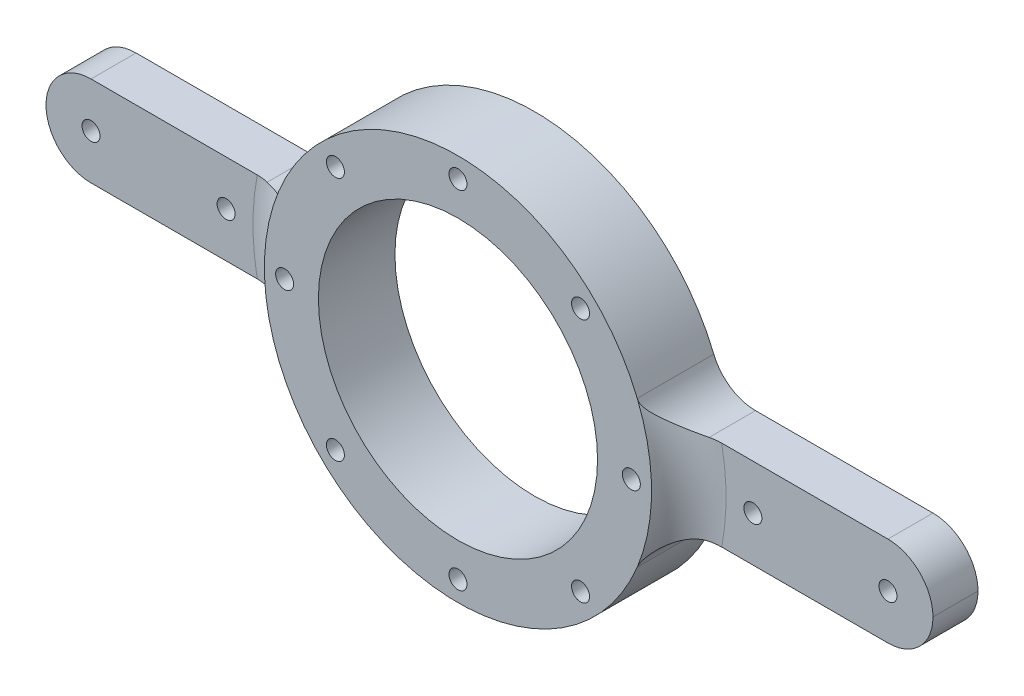
from build123d import *

# Parameters (mm, degrees)
SKETCH1_R           = 2
SKETCH1_R_2         = 31
BOSS_EXTRUDE1_DEPTH = 17
SKETCH1_3_R         = 2
BOSS_EXTRUDE2_DEPTH = 10
FILLET1_R           = 10
FILLET2_R           = 10


# Some blends are built 0.0001 mm under size
with BuildPart() as part:
    # Sketch1 → Boss-Extrude1 (new body)
    with BuildSketch(Plane.XY):
        with BuildLine():
            ThreePointArc((41.821047333, 10), (0, 43), (-41.821047333, 10))
            ThreePointArc((-41.821047333, 10), (-43, 0), (-41.821047333, -10))
            ThreePointArc((-41.821047333, -10), (-41.80718648, -10.057790941), (-41.793245769, -10.11556267))
            ThreePointArc((-41.793245769, -10.11556267), (-0.129174326, -42.999805976), (41.731716335, -10.366477306))
            ThreePointArc((41.731716335, -10.366477306), (41.776783691, -10.183336608), (41.821047333, -10))
            ThreePointArc((41.821047333, -10), (43, 0), (41.821047333, 10))
        make_face()
        with Locations((-27.223611076, -27.223611076)):
            Circle(SKETCH1_R, mode=Mode.SUBTRACT)
        with Locations((0, -38.5)):
            Circle(SKETCH1_R, mode=Mode.SUBTRACT)
        with Locations((27.223611076, -27.223611076)):
            Circle(SKETCH1_R, mode=Mode.SUBTRACT)
        with Locations((-38.5, 0)):
            Circle(SKETCH1_R, mode=Mode.SUBTRACT)
        with Locations((-27.223611076, 27.223611076)):
            Circle(SKETCH1_R, mode=Mode.SUBTRACT)
        Circle(SKETCH1_R_2, mode=Mode.SUBTRACT)
        with Locations((38.5, 0)):
            Circle(SKETCH1_R, mode=Mode.SUBTRACT)
        with Locations((27.223611076, 27.223611076)):
            Circle(SKETCH1_R, mode=Mode.SUBTRACT)
        with Locations((0, 38.5)):
            Circle(SKETCH1_R, mode=Mode.SUBTRACT)
    extrude(amount=BOSS_EXTRUDE1_DEPTH)

    # Sketch1<3> → Boss-Extrude2 (add)
    # profile 1 of 2: a face of its own
    with BuildSketch(Plane.XY):
        with BuildLine():
            ThreePointArc((-41.821047333, -10), (-43, 0), (-41.821047333, 10))
            Line((-41.821047333, 10), (-98.5, 10))
            Line((-98.5, 10), (-98.5, -10))
            Line((-98.5, -10), (-41.821047333, -10))
        make_face()
        with Locations((-88.5, 0)):
            Circle(SKETCH1_3_R, mode=Mode.SUBTRACT)
        with Locations((-58.5, 0)):
            Circle(SKETCH1_3_R, mode=Mode.SUBTRACT)
    # profile 2 of 2: a face of its own
    with BuildSketch(Plane.XY):
        with BuildLine():
            Line((98.5, 10), (41.821047333, 10))
            ThreePointArc((41.821047333, 10), (43, 0), (41.821047333, -10))
            Line((41.821047333, -10), (98.5, -10))
            Line((98.5, -10), (98.5, 10))
        make_face()
        with Locations((58.5, 0)):
            Circle(SKETCH1_3_R, mode=Mode.SUBTRACT)
        with Locations((88.5, 0)):
            Circle(SKETCH1_3_R, mode=Mode.SUBTRACT)
    extrude(amount=BOSS_EXTRUDE2_DEPTH)

    # Fillet1
    # the kernel refuses this fillet: 10 mm, written as the material it adds along each edge
    with BuildSketch(Plane(origin=(0, 0, 10), x_dir=(-0.7043119936118605, -0.7098905659709015, 0), z_dir=(0.7098905659709015, -0.7043119936118605, 0))) as fillet1_piece_1_section:
        with BuildLine():
            CenterArc((52.539392014, -10), FILLET1_R, 90, 72.542396876)
            Line((52.539392014, 0), (52.539392014, 0.2))
            Line((52.539392014, 0.2), (43, 0.2))
            Line((43, 0.2), (42.8, 0))
            ThreePointArc((42.8, 0), (42.8, -3.5), (42.80921216, -6.94))
            Line((42.80921216, -6.94), (43, -7))
        make_face()
    fillet1_piece_1 = revolve(axis=Axis((0, 0, 10), (0, 0, -1)), revolution_arc=90.452024347, mode=Mode.PRIVATE)
    fillet1_piece_1 = split(fillet1_piece_1, bisect_by=Plane(origin=(-44.895509483, 10, 11.788543671), z_dir=(0, -1, 0)), keep=Keep.TOP, mode=Mode.PRIVATE)
    fillet1_piece_1 = split(fillet1_piece_1, bisect_by=Plane(origin=(-44.895509483, -10, 11.788543671), z_dir=(0, 1, 0)), keep=Keep.TOP, mode=Mode.PRIVATE)
    add(fillet1_piece_1)
    with BuildSketch(Plane(origin=(-41.821047333, -10, 0), x_dir=(0.30584389927154154, -0.952081671537888, 0), z_dir=(0, 0, 1)), Plane(origin=(41.821047333, 10, 0), x_dir=(-0.30584389927146016, 0.9520816715379143, 0), z_dir=(0, 0, 1))) as fillet1_piece_2:
        with BuildLine():
            CenterArc((7.300231752, -9.971044568), FILLET1_R, 94.36121506, 67.829842836)
            Line((-2.220584963, -6.912605575), (-2.411001297, -6.851436795))
            Line((-2.411001297, -6.851436795), (-0.190416334, 0.06116878))
            Line((-0.190416334, 0.06116878), (0.015208816, 0.199420891))
            ThreePointArc((0.015208816, 0.199420891), (3.269895472, 0.075491643), (6.524582129, 0.199420891))
            Line((6.524582129, 0.199420891), (6.539790945, 0))
        make_face()
    extrude(amount=10)
    with BuildSketch(Plane(origin=(-41.821047333, 10, 0), x_dir=(0.3058438992715413, 0.9520816715378883, 0), z_dir=(0, 0, 1)), Plane(origin=(41.821047333, -10, 0), x_dir=(-0.30584389927145916, -0.9520816715379147, 0), z_dir=(0, 0, 1))) as fillet1_piece_3:
        with BuildLine():
            CenterArc((7.300231752, 9.971044568), FILLET1_R, 197.808942104, 67.829842836)
            Line((-2.220584963, 6.912605575), (-2.411001297, 6.851436795))
            Line((-2.411001297, 6.851436795), (-0.190416334, -0.06116878))
            Line((-0.190416334, -0.06116878), (0.015208816, -0.199420891))
            ThreePointArc((0.015208816, -0.199420891), (3.269895472, -0.075491643), (6.524582129, -0.199420891))
            Line((6.524582129, -0.199420891), (6.539790945, 0))
        make_face()
    extrude(amount=10)
    with BuildSketch(Plane(origin=(0, 0, 10), x_dir=(0.7043119936118566, 0.709890565970905, 0), z_dir=(-0.709890565970905, 0.7043119936118566, 0))) as fillet1_piece_4_section:
        with BuildLine():
            CenterArc((52.539392014, -10), FILLET1_R, 90, 72.542396876)
            Line((52.539392014, 0), (52.539392014, 0.2))
            Line((52.539392014, 0.2), (43, 0.2))
            Line((43, 0.2), (42.8, 0))
            ThreePointArc((42.8, 0), (42.8, -3.5), (42.80921216, -6.94))
            Line((42.80921216, -6.94), (43, -7))
        make_face()
    fillet1_piece_4 = revolve(axis=Axis((0, 0, 10), (0, 0, -1)), revolution_arc=90.452024347, mode=Mode.PRIVATE)
    fillet1_piece_4 = split(fillet1_piece_4, bisect_by=Plane(origin=(44.895509483, -10, 11.788543671), z_dir=(0, 1, 0)), keep=Keep.TOP, mode=Mode.PRIVATE)
    fillet1_piece_4 = split(fillet1_piece_4, bisect_by=Plane(origin=(44.895509483, 10, 11.788543671), z_dir=(0, -1, 0)), keep=Keep.TOP, mode=Mode.PRIVATE)
    add(fillet1_piece_4)
    with BuildSketch(Plane(origin=(0, 0, 10), x_dir=(-0.7043119936118605, -0.7098905659709015, 0), z_dir=(0.7098905659709015, -0.7043119936118605, 0))) as fillet1_piece_5a_section:
        with BuildLine():
            CenterArc((52.539392014, -10), FILLET1_R, 90, 72.542396876)
            Line((52.539392014, 0), (52.539392014, 0.2))
            Line((52.539392014, 0.2), (43, 0.2))
            Line((43, 0.2), (42.8, 0))
            ThreePointArc((42.8, 0), (42.8, -3.5), (42.80921216, -6.94))
            Line((42.80921216, -6.94), (43, -7))
        make_face()
    fillet1_piece_5a = revolve(axis=Axis((0, 0, 10), (0, 0, -1)), revolution_arc=90.452024347, mode=Mode.PRIVATE)
    fillet1_piece_5a = split(fillet1_piece_5a, bisect_by=Plane(origin=(-39.191113565, -10, 11.725292832), z_dir=(0, -1, 0)), keep=Keep.TOP, mode=Mode.PRIVATE)
    with BuildSketch(Plane(origin=(-41.821047333, -10, 0), x_dir=(0.30584389927154154, -0.952081671537888, 0), z_dir=(0, 0, 1))) as fillet1_piece_5b_section:
        with BuildLine():
            CenterArc((7.300231752, -9.971044568), FILLET1_R, 94.36121506, 67.829842836)
            Line((-2.220584963, -6.912605575), (-2.411001297, -6.851436795))
            Line((-2.411001297, -6.851436795), (-0.190416334, 0.06116878))
            Line((-0.190416334, 0.06116878), (0.015208816, 0.199420891))
            ThreePointArc((0.015208816, 0.199420891), (3.269895472, 0.075491643), (6.524582129, 0.199420891))
            Line((6.524582129, 0.199420891), (6.539790945, 0))
        make_face()
    fillet1_piece_5b = extrude(amount=28.151293586, mode=Mode.PRIVATE)
    fillet1_piece_5b = split(fillet1_piece_5b, bisect_by=Plane(origin=(-43.086853449, -11.367069141, 17), z_dir=(0, 0, -1)), keep=Keep.TOP, mode=Mode.PRIVATE)
    fillet1_piece_5b = split(fillet1_piece_5b, bisect_by=Plane(origin=(-43.086853449, -11.367069141, 10), z_dir=(0, 0, 1)), keep=Keep.TOP, mode=Mode.PRIVATE)
    fillet1_piece_5 = fillet1_piece_5a & fillet1_piece_5b
    add(fillet1_piece_5)
    with BuildSketch(Plane(origin=(-41.821047333, 10, 0), x_dir=(0.3058438992715413, 0.9520816715378883, 0), z_dir=(0, 0, 1))) as fillet1_piece_6a_section:
        with BuildLine():
            CenterArc((7.300231752, 9.971044568), FILLET1_R, 197.808942104, 67.829842836)
            Line((-2.220584963, 6.912605575), (-2.411001297, 6.851436795))
            Line((-2.411001297, 6.851436795), (-0.190416334, -0.06116878))
            Line((-0.190416334, -0.06116878), (0.015208816, -0.199420891))
            ThreePointArc((0.015208816, -0.199420891), (3.269895472, -0.075491643), (6.524582129, -0.199420891))
            Line((6.524582129, -0.199420891), (6.539790945, 0))
        make_face()
    fillet1_piece_6a = extrude(amount=28.151293586, mode=Mode.PRIVATE)
    fillet1_piece_6a = split(fillet1_piece_6a, bisect_by=Plane(origin=(-43.086853449, 11.367069141, 17), z_dir=(0, 0, -1)), keep=Keep.TOP, mode=Mode.PRIVATE)
    fillet1_piece_6a = split(fillet1_piece_6a, bisect_by=Plane(origin=(-43.086853449, 11.367069141, 10), z_dir=(0, 0, 1)), keep=Keep.TOP, mode=Mode.PRIVATE)
    with BuildSketch(Plane(origin=(0, 0, 10), x_dir=(-0.7043119936118605, -0.7098905659709015, 0), z_dir=(0.7098905659709015, -0.7043119936118605, 0))) as fillet1_piece_6b_section:
        with BuildLine():
            CenterArc((52.539392014, -10), FILLET1_R, 90, 72.542396876)
            Line((52.539392014, 0), (52.539392014, 0.2))
            Line((52.539392014, 0.2), (43, 0.2))
            Line((43, 0.2), (42.8, 0))
            ThreePointArc((42.8, 0), (42.8, -3.5), (42.80921216, -6.94))
            Line((42.80921216, -6.94), (43, -7))
        make_face()
    fillet1_piece_6b = revolve(axis=Axis((0, 0, 10), (0, 0, -1)), revolution_arc=90.452024347, mode=Mode.PRIVATE)
    fillet1_piece_6b = split(fillet1_piece_6b, bisect_by=Plane(origin=(-39.191113142, 10, 11.725292885), z_dir=(0, 1, 0)), keep=Keep.TOP, mode=Mode.PRIVATE)
    fillet1_piece_6 = fillet1_piece_6a & fillet1_piece_6b
    add(fillet1_piece_6)
    with BuildSketch(Plane(origin=(0, 0, 10), x_dir=(0.7043119936118566, 0.709890565970905, 0), z_dir=(-0.709890565970905, 0.7043119936118566, 0))) as fillet1_piece_7a_section:
        with BuildLine():
            CenterArc((52.539392014, -10), FILLET1_R, 90, 72.542396876)
            Line((52.539392014, 0), (52.539392014, 0.2))
            Line((52.539392014, 0.2), (43, 0.2))
            Line((43, 0.2), (42.8, 0))
            ThreePointArc((42.8, 0), (42.8, -3.5), (42.80921216, -6.94))
            Line((42.80921216, -6.94), (43, -7))
        make_face()
    fillet1_piece_7a = revolve(axis=Axis((0, 0, 10), (0, 0, -1)), revolution_arc=90.452024347, mode=Mode.PRIVATE)
    fillet1_piece_7a = split(fillet1_piece_7a, bisect_by=Plane(origin=(39.191113565, 10, 11.725292832), z_dir=(0, 1, 0)), keep=Keep.TOP, mode=Mode.PRIVATE)
    with BuildSketch(Plane(origin=(41.821047333, 10, 0), x_dir=(-0.30584389927146016, 0.9520816715379143, 0), z_dir=(0, 0, 1))) as fillet1_piece_7b_section:
        with BuildLine():
            CenterArc((7.300231752, -9.971044568), FILLET1_R, 94.36121506, 67.829842836)
            Line((-2.220584963, -6.912605575), (-2.411001297, -6.851436795))
            Line((-2.411001297, -6.851436795), (-0.190416334, 0.06116878))
            Line((-0.190416334, 0.06116878), (0.015208816, 0.199420891))
            ThreePointArc((0.015208816, 0.199420891), (3.269895472, 0.075491643), (6.524582129, 0.199420891))
            Line((6.524582129, 0.199420891), (6.539790945, 0))
        make_face()
    fillet1_piece_7b = extrude(amount=28.151293586, mode=Mode.PRIVATE)
    fillet1_piece_7b = split(fillet1_piece_7b, bisect_by=Plane(origin=(43.086853449, 11.367069141, 17), z_dir=(0, 0, -1)), keep=Keep.TOP, mode=Mode.PRIVATE)
    fillet1_piece_7b = split(fillet1_piece_7b, bisect_by=Plane(origin=(43.086853449, 11.367069141, 10), z_dir=(0, 0, 1)), keep=Keep.TOP, mode=Mode.PRIVATE)
    fillet1_piece_7 = fillet1_piece_7a & fillet1_piece_7b
    add(fillet1_piece_7)
    with BuildSketch(Plane(origin=(41.821047333, -10, 0), x_dir=(-0.30584389927145916, -0.9520816715379147, 0), z_dir=(0, 0, 1))) as fillet1_piece_8a_section:
        with BuildLine():
            CenterArc((7.300231752, 9.971044568), FILLET1_R, 197.808942104, 67.829842836)
            Line((-2.220584963, 6.912605575), (-2.411001297, 6.851436795))
            Line((-2.411001297, 6.851436795), (-0.190416334, -0.06116878))
            Line((-0.190416334, -0.06116878), (0.015208816, -0.199420891))
            ThreePointArc((0.015208816, -0.199420891), (3.269895472, -0.075491643), (6.524582129, -0.199420891))
            Line((6.524582129, -0.199420891), (6.539790945, 0))
        make_face()
    fillet1_piece_8a = extrude(amount=28.151293586, mode=Mode.PRIVATE)
    fillet1_piece_8a = split(fillet1_piece_8a, bisect_by=Plane(origin=(43.086853449, -11.367069141, 17), z_dir=(0, 0, -1)), keep=Keep.TOP, mode=Mode.PRIVATE)
    fillet1_piece_8a = split(fillet1_piece_8a, bisect_by=Plane(origin=(43.086853449, -11.367069141, 10), z_dir=(0, 0, 1)), keep=Keep.TOP, mode=Mode.PRIVATE)
    with BuildSketch(Plane(origin=(0, 0, 10), x_dir=(0.7043119936118566, 0.709890565970905, 0), z_dir=(-0.709890565970905, 0.7043119936118566, 0))) as fillet1_piece_8b_section:
        with BuildLine():
            CenterArc((52.539392014, -10), FILLET1_R, 90, 72.542396876)
            Line((52.539392014, 0), (52.539392014, 0.2))
            Line((52.539392014, 0.2), (43, 0.2))
            Line((43, 0.2), (42.8, 0))
            ThreePointArc((42.8, 0), (42.8, -3.5), (42.80921216, -6.94))
            Line((42.80921216, -6.94), (43, -7))
        make_face()
    fillet1_piece_8b = revolve(axis=Axis((0, 0, 10), (0, 0, -1)), revolution_arc=90.452024347, mode=Mode.PRIVATE)
    fillet1_piece_8b = split(fillet1_piece_8b, bisect_by=Plane(origin=(39.191113142, -10, 11.725292885), z_dir=(0, -1, 0)), keep=Keep.TOP, mode=Mode.PRIVATE)
    fillet1_piece_8 = fillet1_piece_8a & fillet1_piece_8b
    add(fillet1_piece_8)

    # Fillet2
    fillet2_edges = [part.edges().sort_by_distance(p)[0] for p in [
        (98.5, -10, 5),
        (98.5, 10, 5),
        (-98.5, -10, 5),
        (-98.5, 10, 5),
    ]]
    fillet(fillet2_edges, radius=FILLET2_R - 0.0001)  # a hair under: the kernel refuses the full size


solid = part.part
